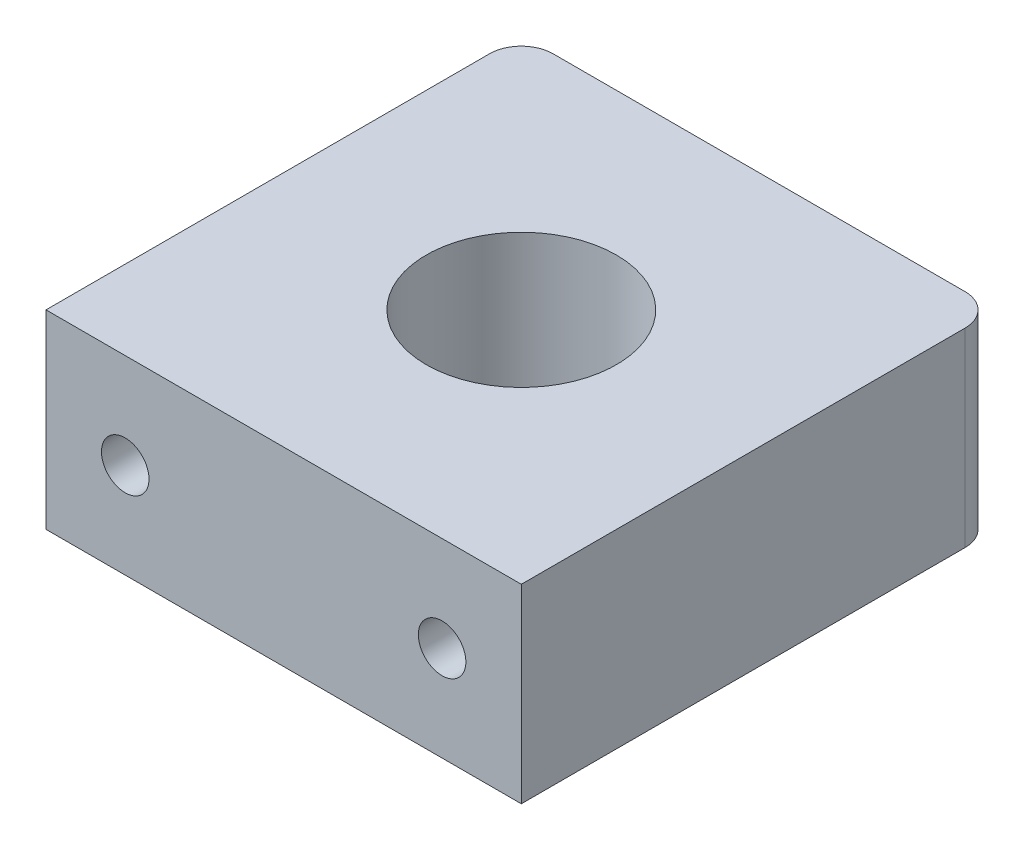
from build123d import *

# Parameters (mm, degrees)
SKETCH1_W           = 30
SKETCH1_H           = 30
SKETCH1_R           = 6
BOSS_EXTRUDE1_DEPTH = 12
FILLET1_R           = 2
SKETCH2_R           = 1.5
CUT_EXTRUDE1_DEPTH  = 5


with BuildPart() as part:
    # Sketch1 → Boss-Extrude1 (new body)
    with BuildSketch(Plane(origin=(0, 0, 0), x_dir=(1, 0, 0), z_dir=(0, 1, 0))):
        with Locations((15, 15)):
            Rectangle(SKETCH1_W, SKETCH1_H)
        with Locations((15, 15)):
            Circle(SKETCH1_R, mode=Mode.SUBTRACT)
    extrude(amount=BOSS_EXTRUDE1_DEPTH)

    # Fillet1
    fillet1_edges = [part.edges().sort_by_distance(p)[0] for p in [
        (30, 6, -30),
        (0, 6, -30),
    ]]
    fillet(fillet1_edges, radius=FILLET1_R)

    # Sketch2 → Cut-Extrude1 (cut)
    with BuildSketch(Plane.XY):
        with Locations((5, 6)):
            Circle(SKETCH2_R)
        with Locations((25, 6)):
            Circle(SKETCH2_R)
    extrude(amount=-CUT_EXTRUDE1_DEPTH, mode=Mode.SUBTRACT)


solid = part.part
